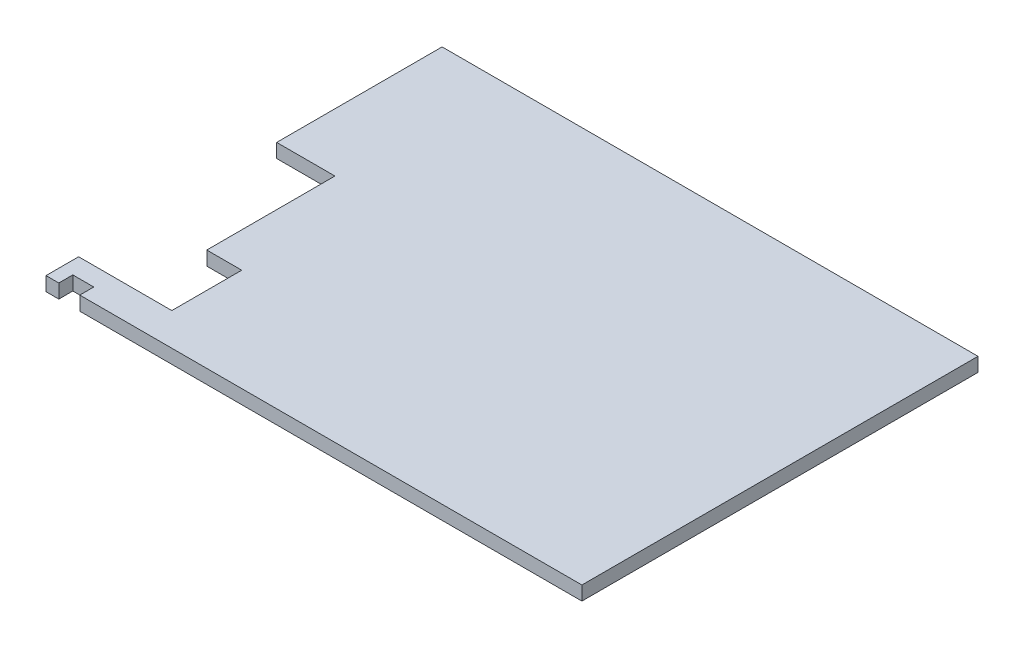
from build123d import *

# Parameters (mm, degrees)
BOSS_EXTRUDE1_DEPTH = 6


with BuildPart() as part:
    # Sketch1 → Boss-Extrude1 (new body)
    with BuildSketch(Plane(origin=(0, 0, 0), x_dir=(1, 0, 0), z_dir=(0, 1, 0))):
        Polygon((14.5, 4.796692747), (230, 4.796692747), (230, 174.796692747), (0, 174.796692747), (0, 103.796692747), (25, 103.796692747), (25, 48.796692747), (40, 48.796692747), (40, 18.796692747), (25, 18.796692747), (18.804365786, 18.796692747), (0, 18.796692747), (0, 4.796692747), (5.5, 4.796692747), (5.5, 10.796692747), (14.5, 10.796692747), align=None)
    extrude(amount=BOSS_EXTRUDE1_DEPTH)


solid = part.part
